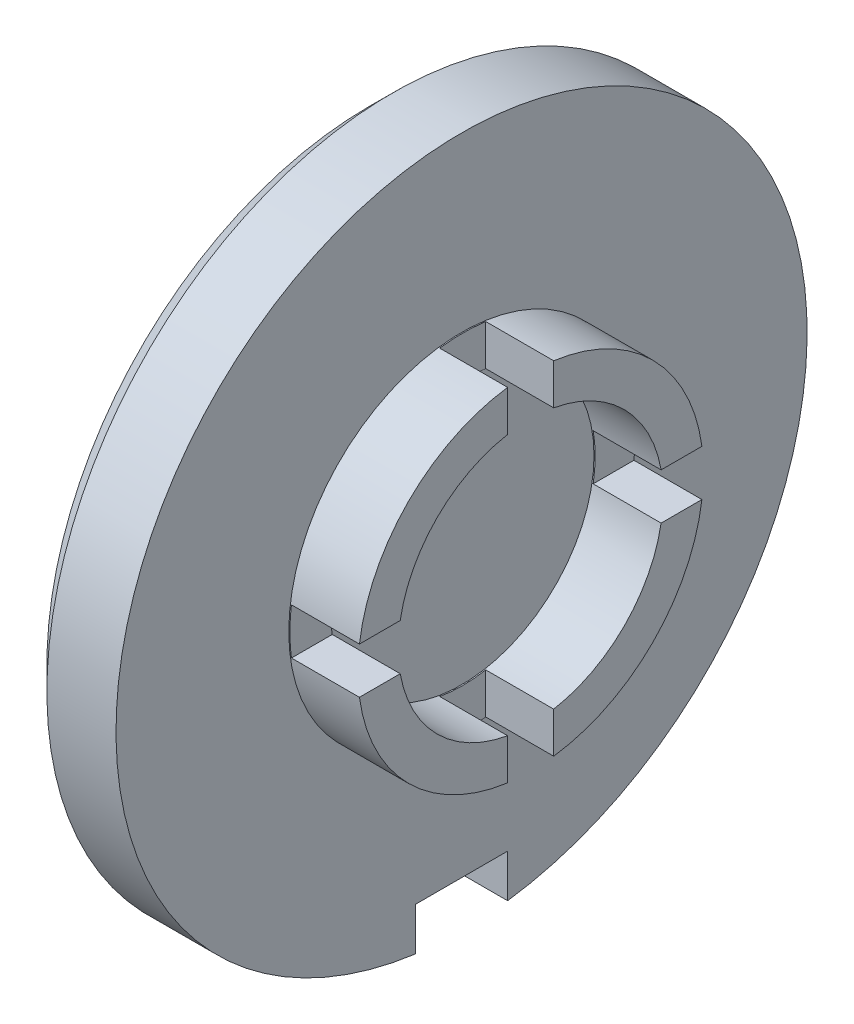
from build123d import *

# Parameters (mm, degrees)
BOSS_EXTRUDE1_START = 62.8
SKETCH2_W           = 1.28
SKETCH2_H           = 0.8
BOSS_EXTRUDE1_DEPTH = 6.4
BOSS_EXTRUDE2_START = 65.6
SKETCH3_W           = 1.28
SKETCH3_H           = 6.4
BOSS_EXTRUDE2_DEPTH = 0.8
BOSS_EXTRUDE3_START = 65.2
SKETCH4_W           = 1.8
SKETCH4_H           = 0.9
BOSS_EXTRUDE3_DEPTH = 1.6


with BuildPart() as part:
    # Sketch1 → Revolve1 (revolve)
    with BuildSketch(Plane.XY.offset(66)):
        Polygon((-58.2, 20.3), (-59.4, 20.3), (-59.4, 18), (-61, 18), (-61, 23.6), (-60.6, 24), (-59.4, 24), (-59.4, 21), (-58.2, 21), align=None)
    revolve(axis=Axis((-66, 18, 66), (1, 0, 0)))


with BuildPart() as body_2:
    # Sketch2 → Boss-Extrude1 (new body)
    with BuildSketch(Plane.XY.offset(BOSS_EXTRUDE1_START)):
        with Locations((-58.74, 18)):
            Rectangle(SKETCH2_W, SKETCH2_H)
    extrude(amount=BOSS_EXTRUDE1_DEPTH)


with BuildPart() as part_1:
    add(part.part)

    # Combine1: cut body 2
    add(body_2.part, mode=Mode.SUBTRACT)


with BuildPart() as body_2_2:
    # Sketch3 → Boss-Extrude2 (new body)
    with BuildSketch(Plane.XY.offset(BOSS_EXTRUDE2_START)):
        with Locations((-58.74, 18)):
            Rectangle(SKETCH3_W, SKETCH3_H)
    extrude(amount=BOSS_EXTRUDE2_DEPTH)


with BuildPart() as part_2:
    add(part_1.part)

    # Combine2: cut body 2 2
    add(body_2_2.part, mode=Mode.SUBTRACT)


with BuildPart() as body_2_3:
    # Sketch4 → Boss-Extrude3 (new body)
    with BuildSketch(Plane.XY.offset(BOSS_EXTRUDE3_START)):
        with Locations((-60.2, 12.35)):
            Rectangle(SKETCH4_W, SKETCH4_H)
    extrude(amount=BOSS_EXTRUDE3_DEPTH)


with BuildPart() as part_3:
    add(part_2.part)

    # Combine3: cut body 2 3
    add(body_2_3.part, mode=Mode.SUBTRACT)


solid = part_3.part
